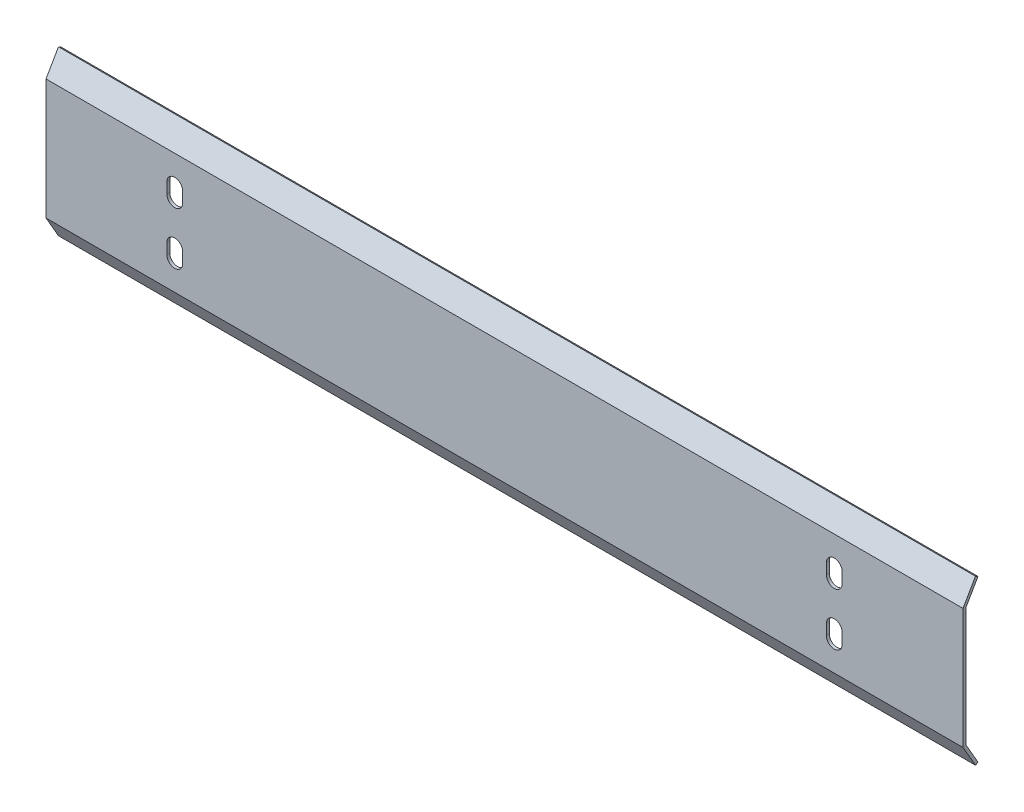
from build123d import *

# Parameters (mm, degrees)
SM_BASE_FLANGE_2_DEPTH        = 349
CUT_EXTRUDE_1_DEPTH           = 10
PATTERN_LINEAR_1_COUNT        = 2
PATTERN_LINEAR_1_PITCH        = 251
PATTERN_LINEAR_1_COPY_1_DEPTH = 10


# Sheet-metal steps are written as plain solids
with BuildPart() as part:
    # 草图2 → 基体-法兰2 (new body)
    with BuildSketch(Plane(origin=(0, 0, 0), x_dir=(0, 0, -1), z_dir=(1, 0, 0))):
        Polygon((0, 0), (0, 45.845517328), (4.75, 54.072758664), (5.702627944, 53.522758664), (1.1, 45.550773216), (1.1, 0.294744112), (5.702627944, -7.677241336), (4.75, -8.227241336), align=None)
    extrude(amount=-SM_BASE_FLANGE_2_DEPTH)

    # 草图11 → 切除-拉伸1 (cut)
    with BuildSketch(Plane.XY):
        with BuildLine():
            Line((-46, 14.922758664), (-46, 10.922758664))
            ThreePointArc((-46, 10.922758664), (-49, 7.922758664), (-52, 10.922758664))
            Line((-52, 10.922758664), (-52, 14.922758664))
            ThreePointArc((-52, 14.922758664), (-49, 17.922758664), (-46, 14.922758664))
        make_face()
    cut_extrude_1 = extrude(amount=-CUT_EXTRUDE_1_DEPTH, mode=Mode.SUBTRACT)

    # 镜向1: 切除-拉伸1 across plane
    add(cut_extrude_1.mirror(Plane.ZX.offset(22.922758664)), mode=Mode.SUBTRACT)

    # 阵列(线性)1: 切除-拉伸1 ×2
    with Locations(*[(-i * PATTERN_LINEAR_1_PITCH, 0, 0) for i in range(1, PATTERN_LINEAR_1_COUNT)]):
        add(cut_extrude_1, mode=Mode.SUBTRACT)

    # 阵列(线性)1 copy 1 sketch → 阵列(线性)1 copy 1 (cut)
    with BuildSketch(Plane(origin=(-251, 45.845517328, 0), x_dir=(1, 0, 0), z_dir=(0, 0, 1))):
        with BuildLine():
            Line((-46, -14.922758664), (-46, -10.922758664))
            ThreePointArc((-46, -10.922758664), (-49, -7.922758664), (-52, -10.922758664))
            Line((-52, -10.922758664), (-52, -14.922758664))
            ThreePointArc((-52, -14.922758664), (-49, -17.922758664), (-46, -14.922758664))
        make_face()
    extrude(amount=-PATTERN_LINEAR_1_COPY_1_DEPTH, mode=Mode.SUBTRACT)


solid = part.part
